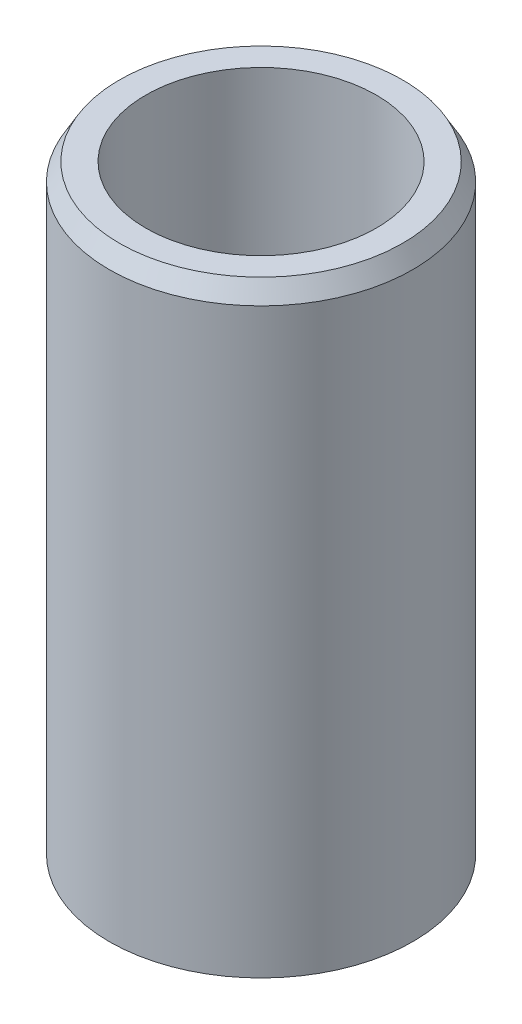
from build123d import *
from OCP.BRepFilletAPI import BRepFilletAPI_MakeChamfer

# Parameters (mm, degrees)
SKETCH1_R           = 45
BOSS_EXTRUDE1_DEPTH = 180.828768563
SKETCH2_R           = 34.183121844
CUT_EXTRUDE1_DEPTH  = 192.700400469
CHAMFER1_SIZE       = 5.242331409
CHAMFER1_SIZE2      = 3.02666145


with BuildPart() as part:
    # Sketch1 → Boss-Extrude1 (new body)
    with BuildSketch(Plane(origin=(0, 0, 0), x_dir=(1, 0, 0), z_dir=(0, 1, 0))):
        Circle(SKETCH1_R)
    extrude(amount=BOSS_EXTRUDE1_DEPTH)

    # Sketch2 → Cut-Extrude1 (cut, through all)
    with BuildSketch(Plane(origin=(0, 0, 0), x_dir=(1, 0, 0), z_dir=(0, 1, 0))):
        Circle(SKETCH2_R)
    extrude(amount=CUT_EXTRUDE1_DEPTH, mode=Mode.SUBTRACT)

    # Chamfer1: one chamfer whose edges measure the first distance from different faces: ONE call of the kernel's chamfer builder (chamfer() names one face for all edges)
    chamfer1_edges_1 = [part.edges().sort_by_distance(p)[0] for p in [
        (-45, 180.828768563, 0),
    ]]
    chamfer1_side_1 = [part.faces().sort_by_distance(p)[0] for p in [
        (-45, 90.414384281, 0),
    ]]
    chamfer1_edges_2 = [part.edges().sort_by_distance(p)[0] for p in [
        (-45, 0, 0),
    ]]
    chamfer1_side_2 = [part.faces().sort_by_distance(p)[0] for p in [
        (-43.727207794, 0, 0),
    ]]
    chamfer1 = BRepFilletAPI_MakeChamfer(part.part.solid().wrapped)
    for e in chamfer1_edges_1:
        chamfer1.Add(CHAMFER1_SIZE, CHAMFER1_SIZE2, e.wrapped, chamfer1_side_1[0].wrapped)  # the first distance lies on this face
    for e in chamfer1_edges_2:
        chamfer1.Add(CHAMFER1_SIZE, CHAMFER1_SIZE2, e.wrapped, chamfer1_side_2[0].wrapped)  # the first distance lies on this face
    add(Compound.cast(chamfer1.Shape()), mode=Mode.REPLACE)


solid = part.part
